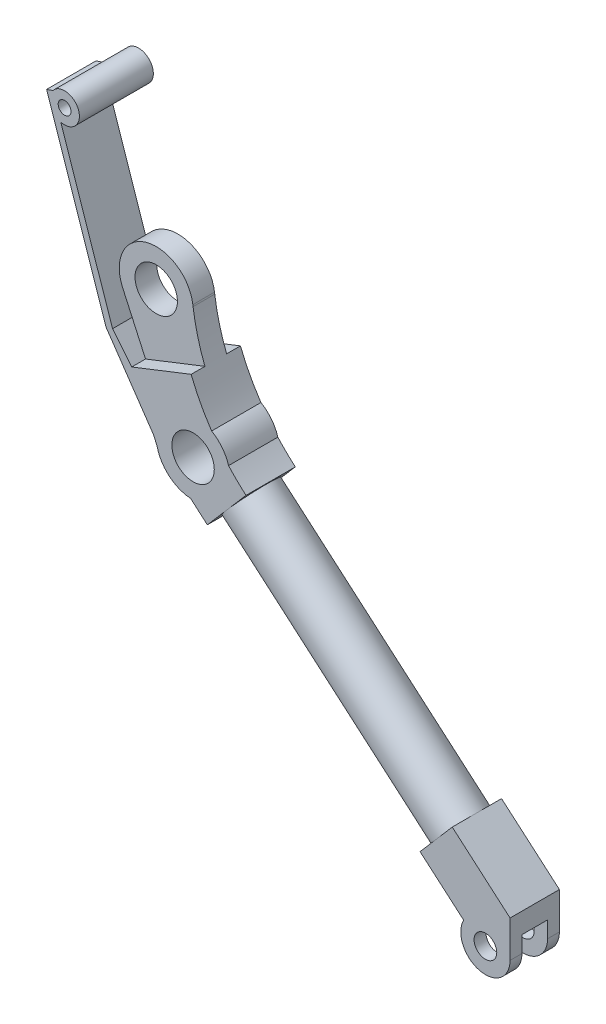
from build123d import *

# Parameters (mm, degrees)
SKETCH1_R               = 3.748314074
SKETCH1_R_2             = 2.15
BOSS_EXTRUDE1_DEPTH     = 1.1
BOSS_EXTRUDE2_START     = -2.5
BOSS_EXTRUDE2_DEPTH     = 5
SKETCH3_R               = 2.5
BOSS_EXTRUDE3_DEPTH     = 30.5
BOSS_EXTRUDE4_REACH     = 66.583
CUT_EXTRUDE1_DEPTH      = 77.014827373
CUT_EXTRUDE1_DEPTH_BACK = 77.014827373
SKETCH5_R               = 2.15
SKETCH6_R               = 1.15
BOSS_EXTRUDE5_DEPTH     = 2.5
SKETCH7_R               = 3
CUT_EXTRUDE2_DEPTH      = 1.3
SKETCH8_R               = 1.5
BOSS_EXTRUDE6_DEPTH     = 7.5
CUT_EXTRUDE3_DEPTH      = 77.681407452
CUT_EXTRUDE3_DEPTH_BACK = 77.681407452
SKETCH9_R               = 0.65


# Read off the part's stored shape, not the designer's step: Boss-Extrude2
with BuildPart() as part:
    # Sketch1 → Boss-Extrude1 (new, symmetric)
    # profile 1 of 2: a face of its own
    with BuildSketch(Plane.XY):
        with BuildLine():
            Line((-29.007745084, 30.523910578), (-25.091893995, 35.069909945))
            ThreePointArc((-25.091893995, 35.069909945), (-29.621942143, 40.692126277), (-31.860472098, 47.55650071))
            Line((-31.860472098, 47.55650071), (-31.88258847, 47.720887837))
            ThreePointArc((-31.88258847, 47.720887837), (-31.857495615, 47.471553034), (-31.84911885, 47.221098797))
            ThreePointArc((-31.84911885, 47.221098797), (-34.80303687, 43.557931682), (-39.009027568, 45.6683978))
            Line((-39.009027568, 45.6683978), (-34.12097225, 34.928362615))
            Line((-34.12097225, 34.928362615), (-29.007745084, 30.523910578))
        make_face()
    # profile 2 of 2: a face of its own
    with BuildSketch(Plane.XY):
        with Locations((-35.597432924, 47.221098797)):
            Circle(SKETCH1_R)
        with Locations((-35.597432924, 47.221098797)):
            Circle(SKETCH1_R_2, mode=Mode.SUBTRACT)
    extrude(amount=BOSS_EXTRUDE1_DEPTH, both=True)

    # Boss-Extrude2 outline → Boss-Extrude2 (add)
    with BuildSketch(Plane.XY.offset(BOSS_EXTRUDE2_START)):
        with BuildLine():
            ThreePointArc((-25.091893995, 35.069909945), (-26.003854199, 35.905963494), (-26.862376119, 36.796804144))
            ThreePointArc((-26.862376119, 36.796804144), (-27.511007835, 38.051535597), (-28.577777167, 38.977320299))
            ThreePointArc((-28.577777167, 38.977320299), (-29.726956647, 40.888456377), (-30.656228901, 42.915648441))
            Line((-30.656228901, 42.915648441), (-36.680056275, 40.551182055))
            Line((-36.680056275, 40.551182055), (-34.12097225, 34.928362615))
            ThreePointArc((-34.12097225, 34.928362615), (-32.905703874, 32.891668535), (-30.711472725, 31.991474297))
            Line((-30.711472725, 31.991474297), (-29.007745084, 30.523910578))
            Line((-29.007745084, 30.523910578), (-25.091893995, 35.069909945))
        make_face()
    extrude(amount=BOSS_EXTRUDE2_DEPTH)

    # Sketch3 → Boss-Extrude3 (add)
    with BuildSketch(Plane(origin=(-31.745759068, 27.345288728, 0), x_dir=(0, 0, -1), z_dir=(0.7576665611269928, -0.6526418482981281, 0))):
        with Locations((0, 7.195277993)):
            Circle(SKETCH3_R)
    extrude(amount=BOSS_EXTRUDE3_DEPTH)

    # Boss-Extrude4: up to this face of the body (flat: up to its plane)
    boss_extrude4_end = Plane(part.part.faces().sort_by_distance((-30.992912772, 36.816549457, 2.5))[0])
    # Sketch4 → Boss-Extrude4 (add, up to the picked face)
    with BuildSketch(Plane(origin=(0, 0, -2.5), x_dir=(-1, 0, 0), z_dir=(0, 0, -1)), mode=Mode.PRIVATE) as boss_extrude4_sk1:
        Polygon((44.67104718, 60.829350293), (38.62968166, 42.935799229), (36.680056275, 40.551182055), (34.487145344, 35.732918139), (39.271055483, 42.725492907), (45.31052994, 60.613442948), align=None)
    boss_extrude4_tool1 = split(extrude(boss_extrude4_sk1.sketch, amount=-BOSS_EXTRUDE4_REACH, mode=Mode.PRIVATE), bisect_by=boss_extrude4_end, keep=Keep.BOTH, mode=Mode.PRIVATE)
    add(boss_extrude4_tool1.solids().sort_by(Axis((-40.62976, 48.582602, -2.5), (0, 0, 1)))[0])

    # Sketch5 → Cut-Extrude1 (cut, two sides: drawn at the far end of the back side and taken through both)
    with BuildSketch(Plane.XY.offset(2.5).offset(-CUT_EXTRUDE1_DEPTH_BACK)):
        with Locations((-30.458296942, 35.732918139)):
            Circle(SKETCH5_R)
    extrude(amount=CUT_EXTRUDE1_DEPTH + CUT_EXTRUDE1_DEPTH_BACK, mode=Mode.SUBTRACT)

    # Sketch6 → Boss-Extrude5 (add, symmetric)
    with BuildSketch(Plane.XY):
        with BuildLine():
            Line((-3.018256327, 8.79690186), (-7.441885155, 12.607344927))
            Line((-7.441885155, 12.607344927), (-4.178675914, 16.395677733))
            Line((-4.178675914, 16.395677733), (1.686549766, 11.343466212))
            Line((1.686549766, 11.343466212), (1.686549766, 7.618415505))
            ThreePointArc((1.686549766, 7.618415505), (-1.420897666, 5.193336616), (-3.018256327, 8.79690186))
        make_face()
        with Locations((-0.813450234, 7.618415505)):
            Circle(SKETCH6_R, mode=Mode.SUBTRACT)
    extrude(amount=BOSS_EXTRUDE5_DEPTH, both=True)

    # Sketch7 → Cut-Extrude2 (cut, symmetric)
    with BuildSketch(Plane.XY):
        with Locations((-0.813450234, 7.618415505)):
            Circle(SKETCH7_R)
    extrude(amount=CUT_EXTRUDE2_DEPTH, both=True, mode=Mode.SUBTRACT)

    # Sketch8 → Boss-Extrude6 (add)
    with BuildSketch(Plane.XY.offset(2.5)):
        with Locations(Location((-43.488619522, 59.906385053, 0), (0, 0, 255.286714902))):
            Circle(SKETCH8_R)
    extrude(amount=-BOSS_EXTRUDE6_DEPTH)

    # Sketch9 → Cut-Extrude3 (cut, two sides: drawn at the far end of the back side and taken through both)
    with BuildSketch(Plane.XY.offset(2.5).offset(-CUT_EXTRUDE3_DEPTH_BACK)):
        with Locations((-43.488619522, 59.906385053)):
            Circle(SKETCH9_R)
    extrude(amount=CUT_EXTRUDE3_DEPTH + CUT_EXTRUDE3_DEPTH_BACK, mode=Mode.SUBTRACT)


with BuildPart() as part_1:
    # Body-Move/Copy1: moved
    add(part.part.moved(Location((35.6, -47.22, 0))))


solid = part_1.part
